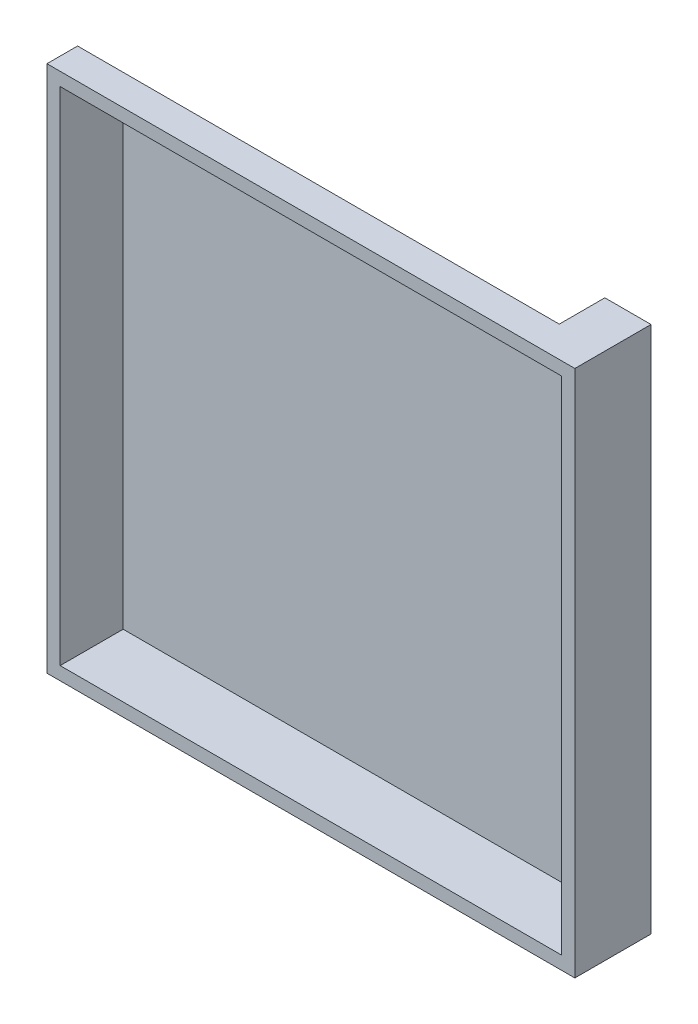
from build123d import *

# Parameters (mm, degrees)
ESQUISSE1_W              = 400
ESQUISSE1_H              = 400
BOSS_EXTRU_1_DEPTH       = 1200
ESQUISSE4_W              = 400
ESQUISSE4_H              = 130.6
ENL_V_MAT_EXTRU_1_DEPTH  = 300
ENL_V_MAT_EXTRU_2_DEPTH  = 100
ESQUISSE13_W             = 400
ESQUISSE13_H             = 400
ENL_V_MAT_EXTRU_10_DEPTH = 400
ENL_V_START              = -35
ENL_V_MAT_EXTRU_11_DEPTH = 400
CONG_3_R                 = 10
ENL_V_MAT_EXTRU_12_DEPTH = 100
CONG_5_R                 = 5
COQUE1_START             = -90
COQUE1_OUTLINE_W         = 380
COQUE1_OUTLINE_H         = 591.664973081
COQUE1_DEPTH             = 280
COQUE1_START_2           = -190
COQUE1_2_DEPTH           = 345.26524617
COQUE1_3_OUTLINE_W       = 380
COQUE1_3_OUTLINE_H       = 150.6
COQUE1_3_DEPTH           = 80
COQUE1_4_DEPTH           = 380
COQUE1_START_3           = 175
COQUE1_5_DEPTH           = 15
ESQUISSE21_W             = 360
ESQUISSE21_H             = 260
ENL_V_MAT_EXTRU_13_DEPTH = 300
ENL_V_MAT_EXTRU_14_DEPTH = 674.894679675
ENL_V_MAT_EXTRU_15_DEPTH = 280
ESQUISSE24_W             = 400
ESQUISSE24_H             = 742.264973081
ENL_V_MAT_EXTRU_16_DEPTH = 1281.624847487
BOSS_EXTRU_2_REACH       = 1257.428
ESQUISSE25_W             = 380
ESQUISSE25_H             = 10


with BuildPart() as part:
    # Esquisse1 → Boss.-Extru.1 (new body)
    with BuildSketch(Plane.XY):
        Rectangle(ESQUISSE1_W, ESQUISSE1_H)
    extrude(amount=BOSS_EXTRU_1_DEPTH)

    # Esquisse4 → Enlèv. mat.-Extru.1 (cut)
    with BuildSketch(Plane(origin=(0, 200, 0), x_dir=(1, 0, 0), z_dir=(0, 1, 0))):
        with Locations((0, -1076.964973081)):
            Rectangle(ESQUISSE4_W, ESQUISSE4_H)
    extrude(amount=-ENL_V_MAT_EXTRU_1_DEPTH, mode=Mode.SUBTRACT)

    # Esquisse5 → Enlèv. mat.-Extru.2 (cut)
    with BuildSketch(Plane.XZ.offset(200)):
        with BuildLine():
            Line((-145, 902.264973081), (145, 902.264973081))
            ThreePointArc((145, 902.264973081), (155.606601718, 897.871574799), (160, 887.264973081))
            Line((160, 887.264973081), (160, 797.264973081))
            ThreePointArc((160, 797.264973081), (155.606601718, 786.658371363), (145, 782.264973081))
            Line((145, 782.264973081), (-145, 782.264973081))
            ThreePointArc((-145, 782.264973081), (-155.606601718, 786.658371363), (-160, 797.264973081))
            Line((-160, 797.264973081), (-160, 887.264973081))
            ThreePointArc((-160, 887.264973081), (-155.606601718, 897.871574799), (-145, 902.264973081))
        make_face()
    extrude(amount=-ENL_V_MAT_EXTRU_2_DEPTH, mode=Mode.SUBTRACT)

    # Esquisse13 → Enlèv. mat.-Extru.10 (cut)
    with BuildSketch(Plane(origin=(0, 0, 0), x_dir=(-1, 0, 0), z_dir=(0, 0, -1))):
        Rectangle(ESQUISSE13_W, ESQUISSE13_H)
    extrude(amount=-ENL_V_MAT_EXTRU_10_DEPTH, mode=Mode.SUBTRACT)

    # Esquisse18 → Enlèv. mat.-Extru.11 (cut)
    with BuildSketch(Plane(origin=(200, 0, 0), x_dir=(0, 0, -1), z_dir=(1, 0, 0)).offset(ENL_V_START)):
        with BuildLine():
            Line((-1142.264973081, 200), (-1176.793054109, 200))
            ThreePointArc((-1176.793054109, 200), (-1165.318675352, 175.963910431), (-1142.264973081, 162.625178063))
            Line((-1142.264973081, 162.625178063), (-1142.264973081, 200))
        make_face()
    extrude(amount=-ENL_V_MAT_EXTRU_11_DEPTH, mode=Mode.SUBTRACT)

    # Congé3
    cong_3_edges = [part.edges().sort_by_distance(p)[0] for p in [
        (-17.5, 162.625178063, 1142.264973081),
    ]]
    fillet(cong_3_edges, radius=CONG_3_R)

    # Esquisse20 → Enlèv. mat.-Extru.12 (cut)
    with BuildSketch(Plane.XZ.offset(200)):
        with BuildLine():
            Line((155, 703.393343593), (-155, 703.393343593))
            ThreePointArc((-155, 703.393343593), (-169.142135624, 697.535479217), (-175, 683.393343593))
            Line((-175, 683.393343593), (-175, 400))
            Line((-175, 400), (175, 400))
            Line((175, 400), (175, 683.393343593))
            ThreePointArc((175, 683.393343593), (169.142135624, 697.535479217), (155, 703.393343593))
        make_face()
    extrude(amount=-ENL_V_MAT_EXTRU_12_DEPTH, mode=Mode.SUBTRACT)

    # Congé5
    cong_5_edges = [part.edges().sort_by_distance(p)[0] for p in [
        (0, -100, 400),
        (175, -150, 400),
        (-175, -150, 400),
    ]]
    fillet(cong_5_edges, radius=CONG_5_R)

    # Coque1: read off the stored shape, not the designer's step
    # Coque1 outline → Coque1 (cut)
    with BuildSketch(Plane(origin=(0, 0, 0), x_dir=(1, 0, 0), z_dir=(0, 1, 0)).offset(COQUE1_START)):
        with Locations((0, -705.83248654)):
            Rectangle(COQUE1_OUTLINE_W, COQUE1_OUTLINE_H)
    extrude(amount=COQUE1_DEPTH, mode=Mode.SUBTRACT)

    # Coque1 2 outline → Coque1 2 (cut)
    # profile 1 of 2: a face of its own
    with BuildSketch(Plane(origin=(0, 0, 0), x_dir=(1, 0, 0), z_dir=(0, 1, 0)).offset(COQUE1_START_2)):
        with BuildLine():
            Line((190, -1001.664973081), (190, -410))
            Line((190, -410), (185, -410))
            Line((185, -410), (185, -683.393343593))
            ThreePointArc((185, -683.393343593), (176.213203435, -704.606547029), (155, -713.393343593))
            Line((155, -713.393343593), (-155, -713.393343593))
            ThreePointArc((-155, -713.393343593), (-176.213203435, -704.606547029), (-185, -683.393343593))
            Line((-185, -683.393343593), (-185, -410))
            Line((-185, -410), (-190, -410))
            Line((-190, -410), (-190, -1001.664973081))
            Line((-190, -1001.664973081), (190, -1001.664973081))
        make_face()
        with BuildLine():
            Line((-170, -887.264973081), (-170, -797.264973081))
            ThreePointArc((-170, -797.264973081), (-162.67766953, -779.587303551), (-145, -772.264973081))
            Line((-145, -772.264973081), (145, -772.264973081))
            ThreePointArc((145, -772.264973081), (162.67766953, -779.587303551), (170, -797.264973081))
            Line((170, -797.264973081), (170, -887.264973081))
            ThreePointArc((170, -887.264973081), (162.67766953, -904.942642611), (145, -912.264973081))
            Line((145, -912.264973081), (-145, -912.264973081))
            ThreePointArc((-145, -912.264973081), (-162.67766953, -904.942642611), (-170, -887.264973081))
        make_face(mode=Mode.SUBTRACT)
    # profile 2 of 2: a face of its own
    with BuildSketch(Plane(origin=(0, 0, 0), x_dir=(1, 0, 0), z_dir=(0, 1, 0)).offset(COQUE1_START_2)):
        Polygon((190, -1200), (190, -1152.264973081), (175, -1152.264973081), (-190, -1152.264973081), (-190, -1200), align=None)
    extrude(amount=COQUE1_2_DEPTH, mode=Mode.SUBTRACT)

    # Coque1 3 outline → Coque1 3 (cut)
    with BuildSketch(Plane(origin=(0, 0, 0), x_dir=(1, 0, 0), z_dir=(0, 1, 0)).offset(COQUE1_START_2)):
        with Locations((0, -1076.964973081)):
            Rectangle(COQUE1_3_OUTLINE_W, COQUE1_3_OUTLINE_H)
    extrude(amount=COQUE1_3_DEPTH, mode=Mode.SUBTRACT)

    # Coque1 4 outline → Coque1 4 (cut)
    with BuildSketch(Plane.YZ.offset(COQUE1_START_2)):
        with BuildLine():
            Line((190, 1184.731629159), (190, 1200))
            Line((190, 1200), (155.26524617, 1200))
            Line((155.26524617, 1200), (155.26524617, 1152.264973081))
            ThreePointArc((155.26524617, 1152.264973081), (168.943107712, 1172.445563441), (190, 1184.731629159))
        make_face()
    extrude(amount=COQUE1_4_DEPTH, mode=Mode.SUBTRACT)

    # Coque1 5 outline → Coque1 5 (cut)
    with BuildSketch(Plane.YZ.offset(COQUE1_START_3)):
        with BuildLine():
            Line((190, 1152.264973081), (190, 1184.731629159))
            ThreePointArc((190, 1184.731629159), (168.943107712, 1172.445563441), (155.26524617, 1152.264973081))
            Line((155.26524617, 1152.264973081), (190, 1152.264973081))
        make_face()
    extrude(amount=COQUE1_5_DEPTH, mode=Mode.SUBTRACT)

    # Esquisse21 → Enlèv. mat.-Extru.13 (cut)
    with BuildSketch(Plane.XY.offset(1011.664973081)):
        with Locations((0, 50)):
            Rectangle(ESQUISSE21_W, ESQUISSE21_H)
    extrude(amount=-ENL_V_MAT_EXTRU_13_DEPTH, mode=Mode.SUBTRACT)

    # Esquisse22 → Enlèv. mat.-Extru.14 (cut, through all)
    with BuildSketch(Plane.XY.offset(1011.664973081)):
        Polygon((-180, 180), (180, 180), (200, 180), (200, 200), (-200, 200), (-200, 180), align=None)
    extrude(amount=-ENL_V_MAT_EXTRU_14_DEPTH, mode=Mode.SUBTRACT)

    # Esquisse23 → Enlèv. mat.-Extru.15 (cut)
    with BuildSketch(Plane(origin=(0, 180, 0), x_dir=(1, 0, 0), z_dir=(0, 1, 0))):
        Polygon((-200, -410), (-190, -410), (190, -410), (200, -410), (200, -400), (-200, -400), align=None)
    extrude(amount=-ENL_V_MAT_EXTRU_15_DEPTH, mode=Mode.SUBTRACT)

    # Esquisse24 → Enlèv. mat.-Extru.16 (cut, through all)
    with BuildSketch(Plane.XZ.offset(200)):
        with Locations((0, 771.132486541)):
            Rectangle(ESQUISSE24_W, ESQUISSE24_H)
    extrude(amount=-ENL_V_MAT_EXTRU_16_DEPTH, mode=Mode.SUBTRACT)

    # Esquisse25 → Boss.-Extru.2 (add, up to next)
    with BuildSketch(Plane.XZ.offset(110), mode=Mode.PRIVATE) as boss_extru_2_sk1:
        with Locations((0, 1147.264973081)):
            Rectangle(ESQUISSE25_W, ESQUISSE25_H)
    boss_extru_2_tool1 = extrude(boss_extru_2_sk1.sketch, amount=BOSS_EXTRU_2_REACH, mode=Mode.PRIVATE) - part.part
    add(boss_extru_2_tool1.solids().sort_by_distance((0, -110, 1147.264973))[0])


solid = part.part
